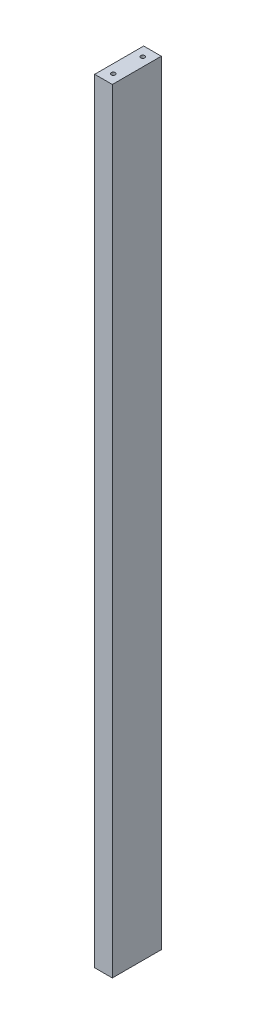
from build123d import *

# Parameters (mm, degrees)
SKETCH1_W                             = 18
SKETCH1_H                             = 50
BASE_DEPTH                            = 789.8
END_BOLT_HOLES_FOR_INSERTS_AT_2_COUNT = 2
END_BOLT_HOLES_FOR_INSERTS_AT_2_PITCH = 30


with BuildPart() as part:
    # Sketch1 → base (new body)
    with BuildSketch(Plane(origin=(0, 0, 0), x_dir=(1, 0, 0), z_dir=(0, 1, 0))):
        with Locations((9, 25)):
            Rectangle(SKETCH1_W, SKETCH1_H)
    extrude(amount=BASE_DEPTH)

    # Sketch3 → end bolt holes for inserts (revolve, cut)
    with BuildSketch(Plane(origin=(9, 0, -40), x_dir=(0, 0, -1), z_dir=(1, 0, 0))):
        Polygon((0, 0), (0, 15.2618073), (2.1, 14), (2.1, 0), align=None)
    end_bolt_holes_for_inserts = revolve(axis=Axis((9, -6.35, -40), (0, 1, 0)), mode=Mode.SUBTRACT)

    # end bolt holes for inserts at 2: end bolt holes for inserts ×2
    with Locations(*[(0, 0, i * END_BOLT_HOLES_FOR_INSERTS_AT_2_PITCH) for i in range(1, END_BOLT_HOLES_FOR_INSERTS_AT_2_COUNT)]):
        add(end_bolt_holes_for_inserts, mode=Mode.SUBTRACT)

    # mirror end bolt holes: end bolt holes for inserts across plane
    add(end_bolt_holes_for_inserts.mirror(Plane(origin=(0, 394.9, 0), x_dir=(0, 0, 1), z_dir=(0, -1, 0))), mode=Mode.SUBTRACT)

    # mirror end bolt holes copy 1 sketch → mirror end bolt holes copy 1 (revolve, cut)
    with BuildSketch(Plane(origin=(9, 789.8, -10), x_dir=(0, 0, -1), z_dir=(1, 0, 0))):
        Polygon((0, 0), (0, -15.2618073), (2.1, -14), (2.1, 0), align=None)
    revolve(axis=Axis((9, 796.15, -10), (0, 1, 0)), mode=Mode.SUBTRACT)


solid = part.part
